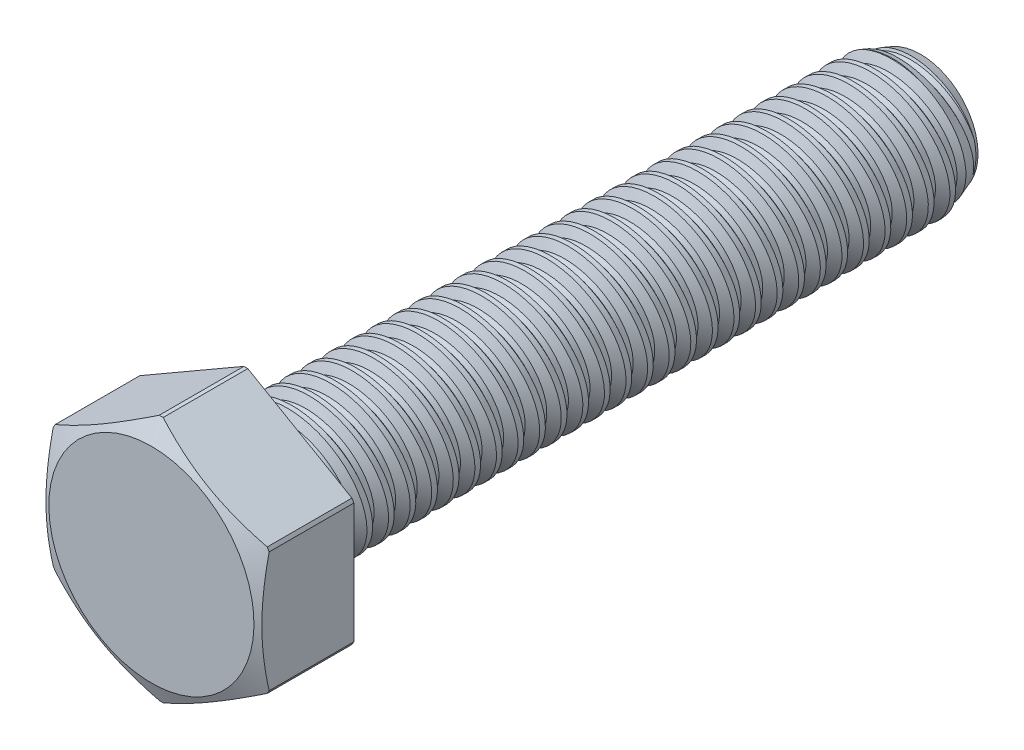
from build123d import *

# Parameters (mm, degrees)
SKETCH1_W       = 25
SKETCH1_H       = 2.5
LPATTERN1_COUNT = 31
LPATTERN1_PITCH = 0.8
LPATTERN2_COUNT = 2
LPATTERN2_PITCH = 0.8
EXTRUDE1_DEPTH  = 3.5


with BuildPart() as part:
    # Sketch1 → Revolve1 (revolve)
    with BuildSketch(Plane(origin=(0, 0, 0), x_dir=(0, 0, -1), z_dir=(1, 0, 0)), mode=Mode.PRIVATE) as revolve1_sk:
        with Locations((0, 1.25)):
            Rectangle(SKETCH1_W, SKETCH1_H)
    revolve(revolve1_sk.sketch.rotate(Axis((0, 0, 12.5), (0, 0, 1)), 143.569663536), axis=Axis((0, 0, 12.5), (0, 0, 1)))

    # Sketch2 → Cut-Revolve1 (revolve, cut)
    with BuildSketch(Plane(origin=(0, 0, 0), x_dir=(0, 0, -1), z_dir=(1, 0, 0)), mode=Mode.PRIVATE) as cut_revolve1_sk:
        Polygon((-12.401255937, 2.51579905), (-11.710047494, 2.626392401), (-11.888495759, 2.15932044), (-12.085983885, 2.127722339), align=None)
    cut_revolve1 = revolve(cut_revolve1_sk.sketch.rotate(Axis((0, -0.136915776, 12.5), (0, 0.15799050110667426, -0.9874406319167052)), 180), axis=Axis((0, -0.136915776, 12.5), (0, 0.15799050110667426, -0.9874406319167052)), mode=Mode.SUBTRACT)

    # Sketch3 → Cut-Revolve2 (revolve, cut)
    with BuildSketch(Plane(origin=(0, 0, 0), x_dir=(0, 0, -1), z_dir=(1, 0, 0)), mode=Mode.PRIVATE) as cut_revolve2_sk:
        Polygon((12.5, 2.127722339), (11.477175534, 2.5), (12.5, 2.5), align=None)
    revolve(cut_revolve2_sk.sketch.rotate(Axis((0, 0, -11.477175534), (0, 0, 1)), 143.569663536), axis=Axis((0, 0, -11.477175534), (0, 0, 1)), mode=Mode.SUBTRACT)

    # LPattern1: Cut-Revolve1 ×31
    with Locations(*[(0, 0, -i * LPATTERN1_PITCH) for i in range(1, LPATTERN1_COUNT)]):
        add(cut_revolve1, mode=Mode.SUBTRACT)

    # LPattern2: Cut-Revolve1 ×2
    with Locations(*[(0, 0, i * LPATTERN2_PITCH) for i in range(1, LPATTERN2_COUNT)]):
        add(cut_revolve1, mode=Mode.SUBTRACT)

    # Sketch4 → Extrude1 (add)
    with BuildSketch(Plane.XY.offset(12.5)):
        Polygon((0, 4.618802154), (-4, 2.309401077), (-4, -2.309401077), (0, -4.618802154), (4, -2.309401077), (4, 2.309401077), align=None)
    extrude(amount=EXTRUDE1_DEPTH)

    # Sketch9 → Cut-Revolve3 (revolve, cut)
    with BuildSketch(Plane(origin=(0, 0, 0), x_dir=(0, 0, -1), z_dir=(1, 0, 0)), mode=Mode.PRIVATE) as cut_revolve3_sk:
        Polygon((-16, 3.8), (-15.637276971, 4.577862046), (-12.5, 4.577862046), (-12.5, 4.618802154), (-16, 4.618802154), align=None)
    revolve(cut_revolve3_sk.sketch.rotate(Axis((0, 0, 0), (0, 0, 1)), 335.413236348), axis=Axis((0, 0, 0), (0, 0, 1)), mode=Mode.SUBTRACT)


solid = part.part
